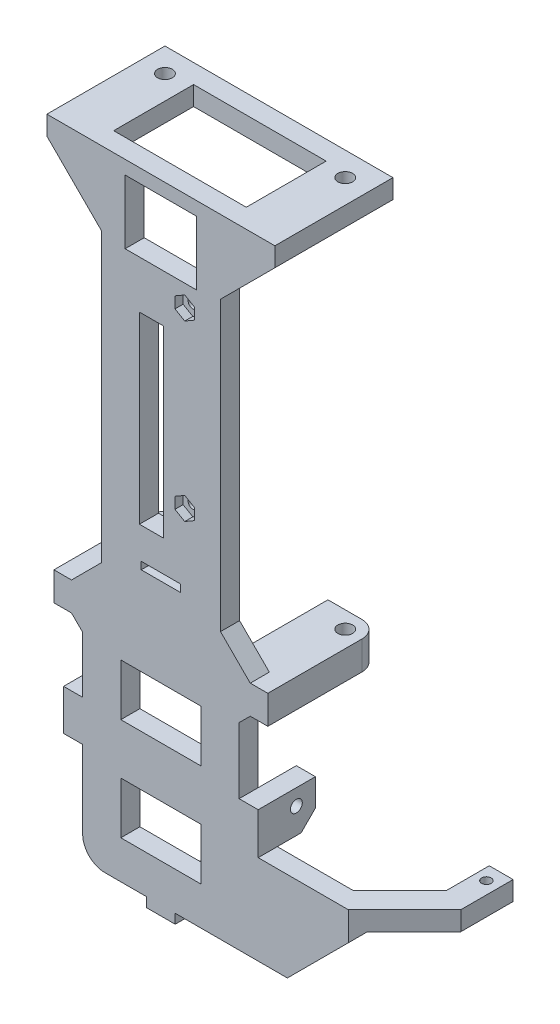
from build123d import *

# Parameters (mm, degrees)
EXTRUDE_1_DEPTH     = 4
SKETCH_2_W          = 15
SKETCH_2_H          = 13.3866
CUT_EXTRUDE_1_DEPTH = 121.93395925
SKETCH_3_W          = 10
SKETCH_3_H          = 10
SKETCH_3_R          = 1.55
SKETCH_3_H_2        = 14.755
EXTRUDE_2_DEPTH     = 4
EXTRUDE_3_DEPTH     = 4
EXTRUDE_4_DEPTH     = 4
SKETCH_7_W          = 27.8
SKETCH_7_H          = 4
EXTRUDE_5_DEPTH     = 4
EXTRUDE_START       = -4
EXTRUDE_6_DEPTH     = 4
SKETCH_11_W         = 16.8
SKETCH_11_H         = 10.85
CUT_EXTRUDE_2_DEPTH = 133.52791749
CHAMFER_1_SIZE      = 2
CHAMFER_2_SIZE      = 2
SKETCH_12_W         = 12
SKETCH_12_H         = 8.55
SKETCH_12_R         = 1.25
EXTRUDE_7_DEPTH     = 4
EXTRUDE_START_2     = 4
SKETCH_13_R         = 1.25
SKETCH_13_W         = 4
SKETCH_13_H         = 8.709663749
EXTRUDE_8_DEPTH     = 4
SKETCH_14_R         = 1
CUT_EXTRUDE_3_DEPTH = 132.839329922
SKETCH_15_R         = 0.9
EXTRUDE_9_DEPTH     = 1
FILLET_1_R          = 0.9
CUT_EXTRUDE_START   = -1.7
SKETCH_16_R         = 1
CUT_EXTRUDE_4_DEPTH = 1.7
CUT_EXTRUDE_5_DEPTH = 132.839329922
SKETCH_19_W         = 5
SKETCH_19_H         = 38.5268
SKETCH_19_W_2       = 8.236887868
SKETCH_19_H_2       = 1.55
CUT_EXTRUDE_6_DEPTH = 132.839329922
EXTRUDE_12_DEPTH    = 23.28
CUT_EXTRUDE_7_REACH = 100.821
SKETCH_23_R         = 1.55
EXTRUDE_13_DEPTH    = 4
CUT_EXTRUDE_START_2 = -19.28
CUT_EXTRUDE_8_DEPTH = 19.48
SKETCH_26_W         = 10.1
SKETCH_26_H         = 2
EXTRUDE_14_DEPTH    = 3


# Read off the part's stored shape, not the designer's step: 切除-拉伸8
with BuildPart() as part:
    # 草图1 → 凸台-拉伸1 (new body)
    with BuildSketch(Plane.XY):
        with BuildLine():
            Line((-16.4, -7.25), (-16.4, 119.75))
            Line((-16.4, 119.75), (16.4, 119.75))
            Line((16.4, 119.75), (16.4, -7.25))
            ThreePointArc((16.4, -7.25), (15.038046533, -10.538046533), (11.75, -11.9))
            Line((11.75, -11.9), (-11.75, -11.9))
            ThreePointArc((-11.75, -11.9), (-15.038046533, -10.538046533), (-16.4, -7.25))
        make_face()
    extrude(amount=EXTRUDE_1_DEPTH)

    # 草图2 → 切除-拉伸1 (cut, through all)
    with BuildSketch(Plane(origin=(0, 0, 0), x_dir=(-1, 0, 0), z_dir=(0, 0, -1))):
        with Locations((0, 110.2067)):
            Rectangle(SKETCH_2_W, SKETCH_2_H)
    extrude(amount=-CUT_EXTRUDE_1_DEPTH, mode=Mode.SUBTRACT)

    # 草图3 → 凸台-拉伸2 (add)
    # profile 1 of 2: a face of its own
    with BuildSketch(Plane(origin=(0, 119.75, 0), x_dir=(1, 0, 0), z_dir=(0, 1, 0))):
        with Locations((-18.9, 15.755)):
            Rectangle(SKETCH_3_W, SKETCH_3_H)
        with Locations(Location((-18.9, 15.755, 0), (0, 0, 270))):
            Circle(SKETCH_3_R, mode=Mode.SUBTRACT)
    # profile 2 of 2: a face of its own
    with BuildSketch(Plane(origin=(0, 119.75, 0), x_dir=(1, 0, 0), z_dir=(0, 1, 0))):
        with Locations((-18.9, 3.3775)):
            Rectangle(SKETCH_3_W, SKETCH_3_H_2)
    extrude_2 = extrude(amount=-EXTRUDE_2_DEPTH)

    # 镜向1: 凸台-拉伸2 across plane
    add(extrude_2.mirror(Plane(origin=(0, 0, 0), x_dir=(0, 0, 1), z_dir=(1, 0, 0))))

    # 草图6 → 凸台-拉伸4 (add)
    with BuildSketch(Plane.XY.offset(4)):
        Polygon((-16.4, 115.75), (-23.9, 115.75), (-16.4, 108.25), align=None)
        Polygon((16.4, 115.75), (16.4, 108.25), (23.9, 115.75), align=None)
    extrude(amount=-EXTRUDE_4_DEPTH)

    # 草图7 → 凸台-拉伸5 (add)
    with BuildSketch(Plane(origin=(0, 119.75, 0), x_dir=(1, 0, 0), z_dir=(0, 1, 0))):
        with Locations((0, 18.755)):
            Rectangle(SKETCH_7_W, SKETCH_7_H)
    extrude(amount=-EXTRUDE_5_DEPTH)



with BuildPart() as body_2:
    # 草图5 → 凸台-拉伸3 (new body)
    with BuildSketch(Plane(origin=(0, 2.890336251, 0), x_dir=(1, 0, 0), z_dir=(0, 1, 0))):
        Polygon((50.795757056, 9.855), (46.095757056, 9.855), (32.240757056, -4), (39.311824868, -4), (51.095757056, 7.783932188), (51.095757056, 9.855), align=None)
        with BuildLine():
            Line((50.795757056, 18.755), (46.095757056, 18.755))
            Line((46.095757056, 18.755), (46.095757056, 9.855))
            Line((46.095757056, 9.855), (50.795757056, 9.855))
            Line((50.795757056, 9.855), (50.795757056, 15.105))
            Line((50.795757056, 15.105), (49.255691264, 15.105))
            ThreePointArc((49.255691264, 15.105), (47.495757056, 15.755), (49.255691264, 16.405))
            Line((49.255691264, 16.405), (50.795757056, 16.405))
            Line((50.795757056, 16.405), (50.795757056, 18.755))
        make_face()
        with BuildLine():
            Line((51.095757056, 18.755), (50.795757056, 18.755))
            Line((50.795757056, 18.755), (50.795757056, 16.405))
            Line((50.795757056, 16.405), (49.255691264, 16.405))
            ThreePointArc((49.255691264, 16.405), (49.433822674, 16.10145764), (49.495757056, 15.755))
            ThreePointArc((49.495757056, 15.755), (49.433822674, 15.40854236), (49.255691264, 15.105))
            Line((49.255691264, 15.105), (50.795757056, 15.105))
            Line((50.795757056, 15.105), (50.795757056, 9.855))
            Line((50.795757056, 9.855), (51.095757056, 9.855))
            Line((51.095757056, 9.855), (51.095757056, 18.755))
        make_face()
    extrude(amount=EXTRUDE_3_DEPTH)


with BuildPart() as part_1:
    add(part.part)

    add(body_2.part)  # 凸台-拉伸6 merges body 2
    # 草图8 → 凸台-拉伸6 (add)
    with BuildSketch(Plane.XY.offset(4).offset(EXTRUDE_START)):
        with BuildLine():
            Line((26.521488617, -11.9), (39.311824868, 0.890336251))
            Line((39.311824868, 0.890336251), (39.311824868, 6.890336251))
            Line((39.311824868, 6.890336251), (16.4, 6.890336251))
            Line((16.4, 6.890336251), (16.4, -7.25))
            ThreePointArc((16.4, -7.25), (15.038046533, -10.538046533), (11.75, -11.9))
            Line((11.75, -11.9), (26.521488617, -11.9))
        make_face()
    extrude(amount=EXTRUDE_6_DEPTH)

    # 草图11 → 切除-拉伸2 (cut, through all)
    with BuildSketch(Plane.XY.offset(4)):
        with Locations((0, 1.525)):
            Rectangle(SKETCH_11_W, SKETCH_11_H)
        with Locations((0, 22.975)):
            Rectangle(SKETCH_11_W, SKETCH_11_H)
    extrude(amount=-CUT_EXTRUDE_2_DEPTH, mode=Mode.SUBTRACT)

    # 倒角1
    chamfer_1_edges = [part_1.edges().sort_by_distance(p)[0] for p in [
        (39.311824868, 2.890336251, 2),
    ]]
    chamfer(chamfer_1_edges, length=CHAMFER_1_SIZE - 0.0001)  # a hair under: the kernel refuses the full size

    # 倒角2
    chamfer_2_edges = [part_1.edges().sort_by_distance(p)[0] for p in [
        (38.776240962, 2.890336251, 0),
    ]]
    chamfer(chamfer_2_edges, length=CHAMFER_2_SIZE - 0.0001)  # a hair under: the kernel refuses the full size

    # 草图12 → 凸台-拉伸7 (add)
    with BuildSketch(Plane.ZY.offset(16.4)):
        with Locations((-2, 13.325)):
            Rectangle(SKETCH_12_W, SKETCH_12_H)
        with Locations((-4, 12.25)):
            Circle(SKETCH_12_R, mode=Mode.SUBTRACT)
    extrude(amount=EXTRUDE_7_DEPTH)

    # 草图13 → 凸台-拉伸8 (add)
    # profile 1 of 2: a face of its own
    with BuildSketch(Plane(origin=(16.4, 0, 0), x_dir=(0, 0, -1), z_dir=(1, 0, 0)).offset(EXTRUDE_START_2)):
        Polygon((8, 9.890336251), (8, 15.6), (0, 15.6), (0, 6.890336251), (5, 6.890336251), align=None)
        with Locations(Location((4, 12.25, 0), (0, 0, 180))):
            Circle(SKETCH_13_R, mode=Mode.SUBTRACT)
    # profile 2 of 2: a face of its own
    with BuildSketch(Plane(origin=(16.4, 0, 0), x_dir=(0, 0, -1), z_dir=(1, 0, 0)).offset(EXTRUDE_START_2)):
        with Locations((-2, 11.245168126)):
            Rectangle(SKETCH_13_W, SKETCH_13_H)
    extrude(amount=-EXTRUDE_8_DEPTH)

    # 草图14 → 切除-拉伸3 (cut, through all)
    with BuildSketch(Plane(origin=(0, 0, 0), x_dir=(-1, 0, 0), z_dir=(0, 0, -1))):
        with Locations((-5, 62.6)):
            Circle(SKETCH_14_R)
        with Locations((-5, 99)):
            Circle(SKETCH_14_R)
    extrude(amount=-CUT_EXTRUDE_3_DEPTH, mode=Mode.SUBTRACT)

    # 草图15 → 凸台-拉伸9 (add)
    with BuildSketch(Plane(origin=(0, 0, 0), x_dir=(-1, 0, 0), z_dir=(0, 0, -1))):
        with Locations(Location((-5, 94.35, 0), (0, 0, 180))):
            Circle(SKETCH_15_R)
        with Locations(Location((-5, 57.98, 0), (0, 0, 180))):
            Circle(SKETCH_15_R)
    extrude(amount=EXTRUDE_9_DEPTH)

    # 圆角1
    fillet_1_edges = [part_1.edges().sort_by_distance(p)[0] for p in [
        (4.1, 94.35, -1),
        (4.1, 57.98, -1),
    ]]
    fillet(fillet_1_edges, radius=FILLET_1_R)

    # 草图16 → 切除-拉伸4 (cut)
    # profile 1 of 2: a face of its own
    with BuildSketch(Plane.XY.offset(4).offset(CUT_EXTRUDE_START)):
        Polygon((7.05, 61.416431948), (7.05, 63.783568052), (5, 64.967136104), (2.95, 63.783568052), (2.95, 61.416431948), (5, 60.232863896), align=None)
        with Locations(Location((5, 62.6, 0), (0, 0, 180))):
            Circle(SKETCH_16_R, mode=Mode.SUBTRACT)
    # profile 2 of 2: a face of its own
    with BuildSketch(Plane.XY.offset(4).offset(CUT_EXTRUDE_START)):
        Polygon((2.95, 97.816431948), (5, 96.632863896), (7.05, 97.816431948), (7.05, 100.183568052), (5, 101.367136104), (2.95, 100.183568052), align=None)
        with Locations(Location((5, 99, 0), (0, 0, 180))):
            Circle(SKETCH_16_R, mode=Mode.SUBTRACT)
    extrude(amount=CUT_EXTRUDE_4_DEPTH, mode=Mode.SUBTRACT)

    # 草图17 → 切除-拉伸5 (cut, symmetric)
    with BuildSketch(Plane(origin=(0, 0, 0), x_dir=(-1, 0, 0), z_dir=(0, 0, -1))):
        Polygon((-12.5, 104.35), (-16.4, 108.25), (-16.4, 40.0866), (-12.5, 43.9866), align=None)
    cut_extrude_5 = extrude(amount=CUT_EXTRUDE_5_DEPTH, both=True, mode=Mode.SUBTRACT)

    # 镜向2: 切除-拉伸5 across plane
    add(cut_extrude_5.mirror(Plane(origin=(0, 0, 0), x_dir=(0, 0, 1), z_dir=(1, 0, 0))), mode=Mode.SUBTRACT)

    # 草图19 → 切除-拉伸6 (cut, through all)
    with BuildSketch(Plane(origin=(0, 0, 0), x_dir=(-1, 0, 0), z_dir=(0, 0, -1))):
        with Locations((2, 74.25)):
            Rectangle(SKETCH_19_W, SKETCH_19_H)
        with Locations((0, 47.675)):
            Rectangle(SKETCH_19_W_2, SKETCH_19_H_2)
    extrude(amount=-CUT_EXTRUDE_6_DEPTH, mode=Mode.SUBTRACT)

    # 草图22 → 凸台-拉伸12 (add)
    with BuildSketch(Plane.XY.offset(4)):
        with BuildLine():
            Line((16.4, 32.719535971), (16.4, 31.75))
            Line((16.4, 31.75), (22.425, 31.75))
            Line((22.425, 31.75), (22.425, 37.75))
            Line((22.425, 37.75), (11.75, 37.75))
            Line((11.75, 37.75), (11.75, 36.5))
            ThreePointArc((11.75, 36.5), (14.746431556, 35.435633993), (16.4, 32.719535971))
        make_face()
    extrude_12 = extrude(amount=-EXTRUDE_12_DEPTH)

    # 草图23 → 切除-拉伸7 (cut, up to next)
    with BuildSketch(Plane(origin=(0, 37.75, 0), x_dir=(1, 0, 0), z_dir=(0, 1, 0)), mode=Mode.PRIVATE) as cut_extrude_7_sk1:
        with Locations(Location((18.9, 15.755, 0), (0, 0, 270))):
            Circle(SKETCH_23_R)
    cut_extrude_7_tool1 = extrude(cut_extrude_7_sk1.sketch, amount=-CUT_EXTRUDE_7_REACH, mode=Mode.PRIVATE) & part_1.part
    # 草图23 → 切除-拉伸7 (cut, up to next)
    with BuildSketch(Plane(origin=(0, 37.75, 0), x_dir=(1, 0, 0), z_dir=(0, 1, 0)), mode=Mode.PRIVATE) as cut_extrude_7_sk2:
        with BuildLine():
            ThreePointArc((18.9, 19.28), (21.392551404, 18.247551403), (22.425, 15.754999999))
            Line((22.425, 15.754999999), (22.425, 19.28))
            Line((22.425, 19.28), (18.9, 19.28))
        make_face()
    cut_extrude_7_tool2 = extrude(cut_extrude_7_sk2.sketch, amount=-CUT_EXTRUDE_7_REACH, mode=Mode.PRIVATE) & part_1.part
    cut_extrude_7_1 = cut_extrude_7_tool1.solids().sort_by_distance((18.9, 37.75, -15.755))[0]
    add(cut_extrude_7_1, mode=Mode.SUBTRACT)
    cut_extrude_7_2 = cut_extrude_7_tool2.solids().sort_by_distance((21.637628, 37.75, -18.492628))[0]
    add(cut_extrude_7_2, mode=Mode.SUBTRACT)
    cut_extrude_7 = cut_extrude_7_1 + cut_extrude_7_2  # 切除-拉伸7 as one shape, for the pattern or mirror that repeats it

    # 草图24 → 凸台-拉伸13 (add)
    with BuildSketch(Plane.XY.offset(4)):
        Polygon((16.4, 40.0866), (18.7366, 37.75), (18.7366, 31.75), (16.4, 29.4134), align=None)
    extrude_13 = extrude(amount=-EXTRUDE_13_DEPTH)

    # 镜向3: 凸台-拉伸12, 切除-拉伸7, 凸台-拉伸13 across plane
    add(extrude_12.mirror(Plane(origin=(0, 0, 0), x_dir=(0, 0, 1), z_dir=(1, 0, 0))))
    add(cut_extrude_7.mirror(Plane(origin=(0, 0, 0), x_dir=(0, 0, 1), z_dir=(1, 0, 0))), mode=Mode.SUBTRACT)
    add(extrude_13.mirror(Plane(origin=(0, 0, 0), x_dir=(0, 0, 1), z_dir=(1, 0, 0))))

    # 切除-拉伸8 outline → 切除-拉伸8 (cut)
    with BuildSketch(Plane.XY.offset(CUT_EXTRUDE_START_2)):
        with BuildLine():
            ThreePointArc((-16.4, 31.75), (-16.318817794, 32.615103442), (-16.078105821, 33.45))
            Line((-16.078105821, 33.45), (-22.425, 33.45))
            Line((-22.425, 33.45), (-22.425, 31.75))
            Line((-22.425, 31.75), (-16.4, 31.75))
        make_face()
    extrude(amount=CUT_EXTRUDE_8_DEPTH, mode=Mode.SUBTRACT)

    # 草图26 → 凸台-拉伸14 (add, symmetric)
    with BuildSketch(Plane(origin=(0, 0, 0), x_dir=(0, 0, -1), z_dir=(1, 0, 0))):
        with Locations((1.05, -12.9)):
            Rectangle(SKETCH_26_W, SKETCH_26_H)
        Polygon((8.1, -11.9), (8.1, -13.9), (6.1, -13.9), (6.1, -11.9), (6.1, -10.9), (7.1, -10.9), align=None)
    extrude(amount=EXTRUDE_14_DEPTH, both=True)


solid = part_1.part
